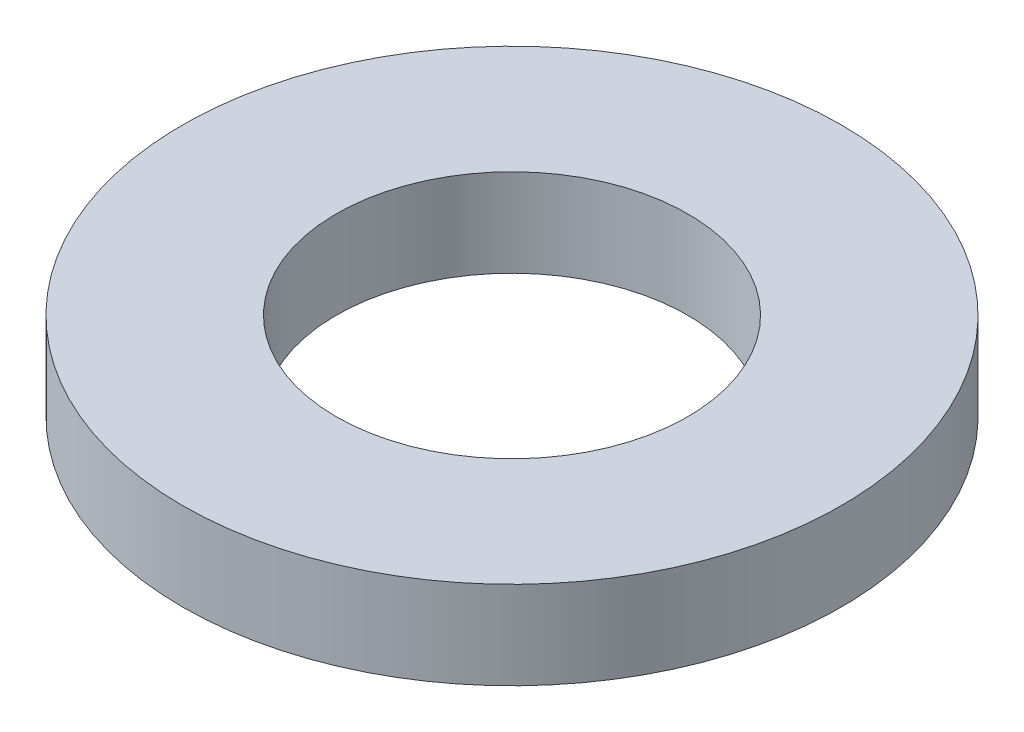
from build123d import *

# Parameters (mm, degrees)
SKETCH1_R           = 75
BOSS_EXTRUDE1_DEPTH = 20
SKETCH2_R           = 40
CUT_EXTRUDE1_DEPTH  = 108.935165725


with BuildPart() as part:
    # Sketch1 → Boss-Extrude1 (new body)
    with BuildSketch(Plane(origin=(0, 0, 0), x_dir=(1, 0, 0), z_dir=(0, 1, 0))):
        Circle(SKETCH1_R)
    extrude(amount=BOSS_EXTRUDE1_DEPTH)

    # Sketch2 → Cut-Extrude1 (cut, through all)
    with BuildSketch(Plane(origin=(0, 0, 0), x_dir=(1, 0, 0), z_dir=(0, 1, 0))):
        Circle(SKETCH2_R)
    extrude(amount=CUT_EXTRUDE1_DEPTH, mode=Mode.SUBTRACT)


solid = part.part
